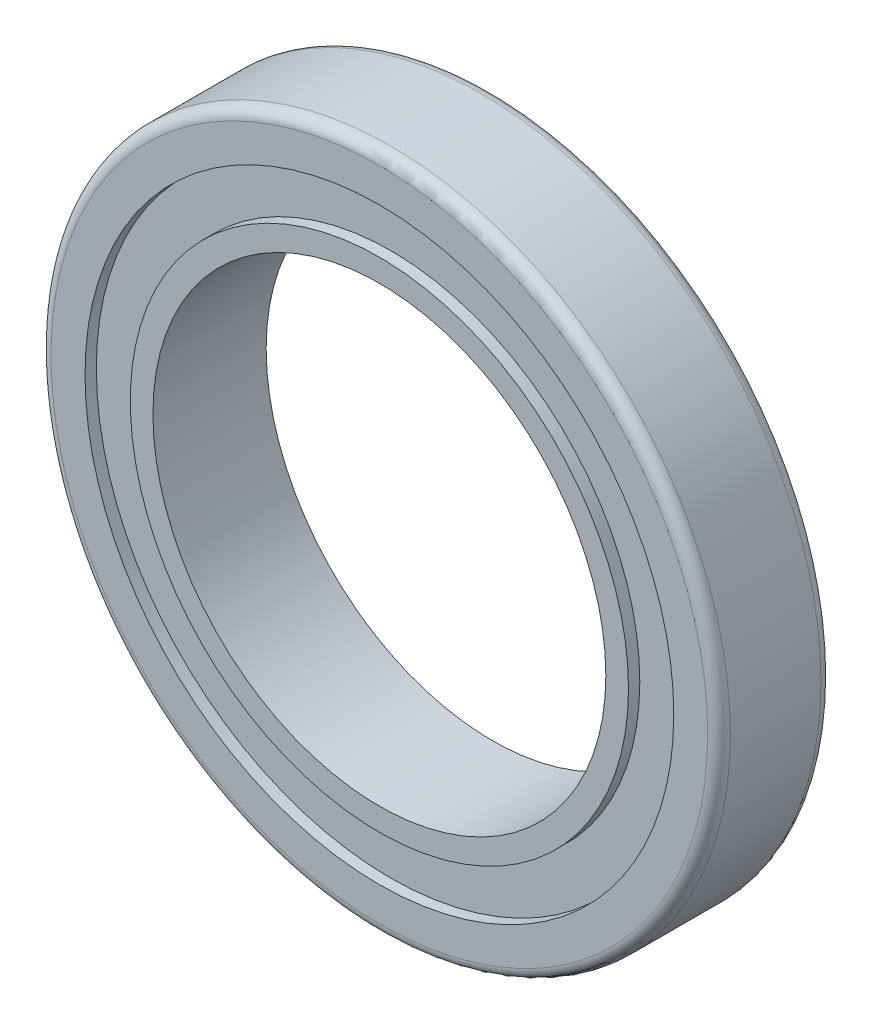
from build123d import *

# Parameters (mm, degrees)
SKETCH1_R           = 15
SKETCH1_R_2         = 10
BOSS_EXTRUDE1_DEPTH = 5
FILLET1_R           = 0.5
SKETCH2_R           = 13
SKETCH2_R_2         = 11
CUT_EXTRUDE1_DEPTH  = 0.5
CUT_EXTRUDE2_START  = -0.5
SKETCH3_R           = 13
SKETCH3_R_2         = 11
CUT_EXTRUDE2_DEPTH  = 0.5


with BuildPart() as part:
    # Sketch1 → Boss-Extrude1 (new body)
    with BuildSketch(Plane.XY):
        with Locations((0, 1.584180911)):
            Circle(SKETCH1_R)
        with Locations((0, 1.584180911)):
            Circle(SKETCH1_R_2, mode=Mode.SUBTRACT)
    extrude(amount=BOSS_EXTRUDE1_DEPTH)

    # Fillet1
    fillet1_edges = [part.edges().sort_by_distance(p)[0] for p in [
        (-15, 1.584180911, 0),
        (-15, 1.584180911, 5),
    ]]
    fillet(fillet1_edges, radius=FILLET1_R)

    # Sketch2 → Cut-Extrude1 (cut)
    with BuildSketch(Plane.XY.offset(5)):
        with Locations((0, 1.584180911)):
            Circle(SKETCH2_R)
        with Locations((0, 1.584180911)):
            Circle(SKETCH2_R_2, mode=Mode.SUBTRACT)
    extrude(amount=-CUT_EXTRUDE1_DEPTH, mode=Mode.SUBTRACT)

    # Sketch3 → Cut-Extrude2 (cut)
    with BuildSketch(Plane(origin=(0, 0, 0), x_dir=(-1, 0, 0), z_dir=(0, 0, -1)).offset(CUT_EXTRUDE2_START)):
        with Locations((0, 1.584180911)):
            Circle(SKETCH3_R)
        with Locations((0, 1.584180911)):
            Circle(SKETCH3_R_2, mode=Mode.SUBTRACT)
    extrude(amount=CUT_EXTRUDE2_DEPTH, mode=Mode.SUBTRACT)


solid = part.part
